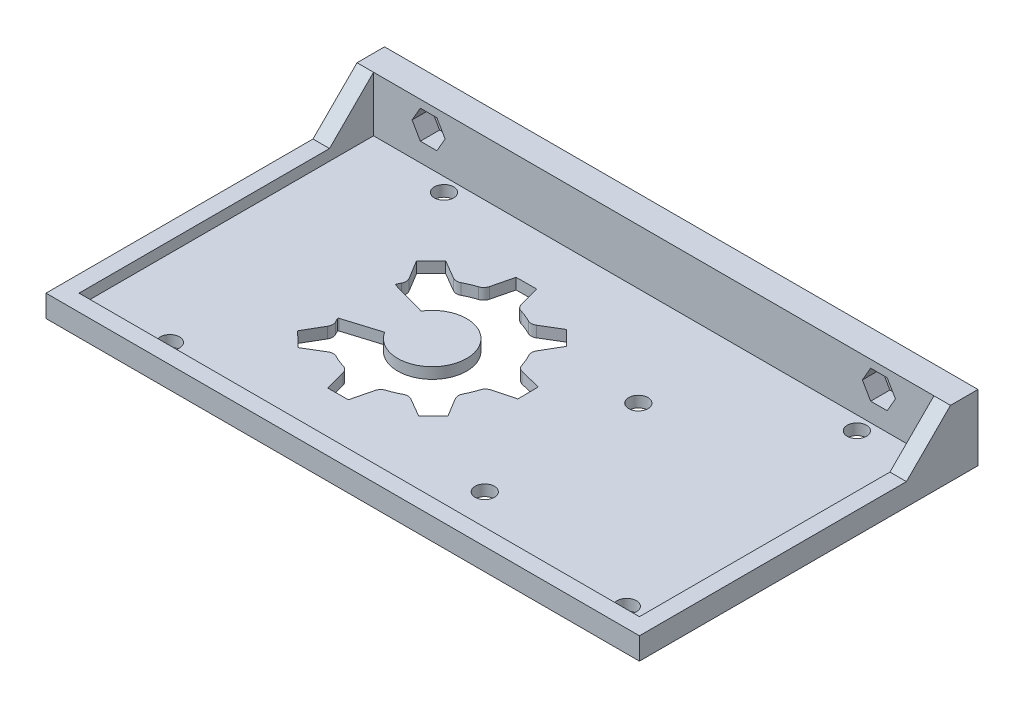
from build123d import *

# Parameters (mm, degrees)
SKETCH1_W           = 107.8
SKETCH1_H           = 59.5
SKETCH1_R           = 1.75
BOSS_EXTRUDE1_DEPTH = 2
BOSS_EXTRUDE2_START = 2
SKETCH1_3_W         = 107.8
SKETCH1_3_H         = 59.5
SKETCH1_3_W_2       = 101.8
SKETCH1_3_H_2       = 53.5
SKETCH1_3_R         = 1.75
BOSS_EXTRUDE2_DEPTH = 2
SKETCH3_W           = 107.8
SKETCH3_H           = 5
BOSS_EXTRUDE3_DEPTH = 12
CHAMFER1_SIZE       = 8
CUT_EXTRUDE1_DEPTH  = 3.5
SKETCH4_4_R         = 1.75
CUT_EXTRUDE3_DEPTH  = 120.663235791


with BuildPart() as part:
    # Sketch1 → Boss-Extrude1 (new body)
    with BuildSketch(Plane(origin=(0, 0, 0), x_dir=(1, 0, 0), z_dir=(0, 1, 0))):
        with Locations((50.9, 26.75)):
            Rectangle(SKETCH1_W, SKETCH1_H)
        with Locations(Location((15.3, 51, 0), (0, 0, 270))):
            Circle(SKETCH1_R, mode=Mode.SUBTRACT)
        with Locations(Location((14, 2.5, 0), (0, 0, 270))):
            Circle(SKETCH1_R, mode=Mode.SUBTRACT)
        with Locations(Location((90.3, 51, 0), (0, 0, 270))):
            Circle(SKETCH1_R, mode=Mode.SUBTRACT)
        with Locations(Location((97, 2.5, 0), (0, 0, 270))):
            Circle(SKETCH1_R, mode=Mode.SUBTRACT)
        with Locations(Location((66.1, 35.5, 0), (0, 0, 270))):
            Circle(SKETCH1_R, mode=Mode.SUBTRACT)
        with Locations(Location((66.1, 7.6, 0), (0, 0, 270))):
            Circle(SKETCH1_R, mode=Mode.SUBTRACT)
        with BuildLine():
            Line((23.594839055, 37.705508722), (26.221634516, 40.37685674))
            Line((26.221634516, 40.37685674), (29.668285754, 38.370965683))
            ThreePointArc((29.668285754, 38.370965683), (30.368695169, 38.175736851), (31.075200762, 38.347601602))
            ThreePointArc((31.075200762, 38.347601602), (32.158474755, 38.867522419), (33.285245302, 39.284881177))
            ThreePointArc((33.285245302, 39.284881177), (33.899901464, 39.673320939), (34.246417166, 40.312550564))
            Line((34.246417166, 40.312550564), (35.200205995, 44.184667628))
            Line((35.200205995, 44.184667628), (38.946559177, 44.216171044))
            Line((38.946559177, 44.216171044), (39.96533047, 40.360641412))
            ThreePointArc((39.96533047, 40.360641412), (40.322547086, 39.727329534), (40.943648713, 39.349281369))
            ThreePointArc((40.943648713, 39.349281369), (42.077278635, 38.950930518), (43.169142938, 38.449300631))
            ThreePointArc((43.169142938, 38.449300631), (43.878438868, 38.28934148), (44.575466073, 38.49632148))
            Line((44.575466073, 38.49632148), (47.987896856, 40.559891165))
            Line((47.987896856, 40.559891165), (50.659244873, 37.933095705))
            Line((50.659244873, 37.933095705), (48.653353816, 34.486444467))
            ThreePointArc((48.653353816, 34.486444467), (48.458124984, 33.786035052), (48.629989735, 33.079529459))
            ThreePointArc((48.629989735, 33.079529459), (49.149910552, 31.996255466), (49.56726931, 30.869484918))
            ThreePointArc((49.56726931, 30.869484918), (49.955709072, 30.254828756), (50.594938697, 29.908313054))
            Line((50.594938697, 29.908313054), (54.467055761, 28.954524225))
            Line((54.467055761, 28.954524225), (54.498559177, 25.208171044))
            Line((54.498559177, 25.208171044), (50.643029545, 24.18939975))
            ThreePointArc((50.643029545, 24.18939975), (50.009717667, 23.832183134), (49.631669502, 23.211081507))
            ThreePointArc((49.631669502, 23.211081507), (49.233318651, 22.077451586), (48.731688764, 20.985587282))
            ThreePointArc((48.731688764, 20.985587282), (48.571729613, 20.276291353), (48.778709614, 19.579264147))
            Line((48.778709614, 19.579264147), (50.842279299, 16.166833365))
            Line((50.842279299, 16.166833365), (48.215483838, 13.495485347))
            Line((48.215483838, 13.495485347), (44.7688326, 15.501376404))
            ThreePointArc((44.7688326, 15.501376404), (44.068423185, 15.696605237), (43.361917592, 15.524740485))
            ThreePointArc((43.361917592, 15.524740485), (42.278643599, 15.004819668), (41.151873051, 14.58746091))
            ThreePointArc((41.151873051, 14.58746091), (40.537216889, 14.199021149), (40.190701187, 13.559791523))
            Line((40.190701187, 13.559791523), (39.236912358, 9.687674459))
            Line((39.236912358, 9.687674459), (35.490559177, 9.656171044))
            Line((35.490559177, 9.656171044), (34.471787883, 13.511700675))
            ThreePointArc((34.471787883, 13.511700675), (34.114571267, 14.145012554), (33.49346964, 14.523060718))
            ThreePointArc((33.49346964, 14.523060718), (32.359839719, 14.921411569), (31.267975415, 15.423041456))
            ThreePointArc((31.267975415, 15.423041456), (30.558679486, 15.583000607), (29.86165228, 15.376020607))
            Line((29.86165228, 15.376020607), (26.449221498, 13.312450922))
            Line((26.449221498, 13.312450922), (23.77787348, 15.939246383))
            Line((23.77787348, 15.939246383), (25.783764538, 19.38589762))
            ThreePointArc((25.783764538, 19.38589762), (25.97899337, 20.086307036), (25.807128618, 20.792812629))
            ThreePointArc((25.807128618, 20.792812629), (25.63505412, 21.123769595), (25.472575587, 21.45954165))
            ThreePointArc((25.472575587, 21.45954165), (25.471521134, 21.57140422), (25.555142885, 21.645712693))
            Line((25.555142885, 21.645712693), (31.904076526, 23.60710923))
            ThreePointArc((31.904076526, 23.60710923), (43.489618325, 26.950155118), (31.889282249, 30.24149793))
            Line((31.889282249, 30.24149793), (25.46834976, 32.027118633))
            ThreePointArc((25.46834976, 32.027118633), (25.382322518, 32.099718242), (25.381148957, 32.212279391))
            ThreePointArc((25.381148957, 32.212279391), (25.538419769, 32.551858304), (25.705429589, 32.886754805))
            ThreePointArc((25.705429589, 32.886754805), (25.86538874, 33.596050734), (25.65840874, 34.29307794))
            Line((25.65840874, 34.29307794), (23.594839055, 37.705508722))
        make_face(mode=Mode.SUBTRACT)
    extrude(amount=BOSS_EXTRUDE1_DEPTH)

    # Sketch1<3> → Boss-Extrude2 (add)
    # profile 1 of 8: a face of its own
    with BuildSketch(Plane(origin=(0, 0, 0), x_dir=(1, 0, 0), z_dir=(0, 1, 0)).offset(BOSS_EXTRUDE2_START)):
        with Locations((50.9, 26.75)):
            Rectangle(SKETCH1_3_W, SKETCH1_3_H)
        with Locations((50.9, 26.75)):
            Rectangle(SKETCH1_3_W_2, SKETCH1_3_H_2, mode=Mode.SUBTRACT)
    # profile 2 of 8: a face of its own
    with BuildSketch(Plane(origin=(0, 0, 0), x_dir=(1, 0, 0), z_dir=(0, 1, 0)).offset(BOSS_EXTRUDE2_START)):
        with Locations(Location((66.1, 7.6, 0), (0, 0, 270))):
            Circle(SKETCH1_3_R)
    # profile 3 of 8: a face of its own
    with BuildSketch(Plane(origin=(0, 0, 0), x_dir=(1, 0, 0), z_dir=(0, 1, 0)).offset(BOSS_EXTRUDE2_START)):
        with Locations(Location((66.1, 35.5, 0), (0, 0, 270))):
            Circle(SKETCH1_3_R)
    # profile 4 of 8: a face of its own
    with BuildSketch(Plane(origin=(0, 0, 0), x_dir=(1, 0, 0), z_dir=(0, 1, 0)).offset(BOSS_EXTRUDE2_START)):
        with Locations(Location((97, 2.5, 0), (0, 0, 270))):
            Circle(SKETCH1_3_R)
    # profile 5 of 8: a face of its own
    with BuildSketch(Plane(origin=(0, 0, 0), x_dir=(1, 0, 0), z_dir=(0, 1, 0)).offset(BOSS_EXTRUDE2_START)):
        with Locations(Location((90.3, 51, 0), (0, 0, 270))):
            Circle(SKETCH1_3_R)
    # profile 6 of 8: a face of its own
    with BuildSketch(Plane(origin=(0, 0, 0), x_dir=(1, 0, 0), z_dir=(0, 1, 0)).offset(BOSS_EXTRUDE2_START)):
        with Locations(Location((14, 2.5, 0), (0, 0, 270))):
            Circle(SKETCH1_3_R)
    # profile 7 of 8: a face of its own
    with BuildSketch(Plane(origin=(0, 0, 0), x_dir=(1, 0, 0), z_dir=(0, 1, 0)).offset(BOSS_EXTRUDE2_START)):
        with Locations(Location((15.3, 51, 0), (0, 0, 270))):
            Circle(SKETCH1_3_R)
    # profile 8 of 8: a face of its own
    with BuildSketch(Plane(origin=(0, 0, 0), x_dir=(1, 0, 0), z_dir=(0, 1, 0)).offset(BOSS_EXTRUDE2_START)):
        with BuildLine():
            Line((23.594839055, 37.705508722), (26.221634516, 40.37685674))
            Line((26.221634516, 40.37685674), (29.668285754, 38.370965683))
            ThreePointArc((29.668285754, 38.370965683), (30.368695169, 38.175736851), (31.075200762, 38.347601602))
            ThreePointArc((31.075200762, 38.347601602), (32.158474755, 38.867522419), (33.285245302, 39.284881177))
            ThreePointArc((33.285245302, 39.284881177), (33.899901464, 39.673320939), (34.246417166, 40.312550564))
            Line((34.246417166, 40.312550564), (35.200205995, 44.184667628))
            Line((35.200205995, 44.184667628), (38.946559177, 44.216171044))
            Line((38.946559177, 44.216171044), (39.96533047, 40.360641412))
            ThreePointArc((39.96533047, 40.360641412), (40.322547086, 39.727329534), (40.943648713, 39.349281369))
            ThreePointArc((40.943648713, 39.349281369), (42.077278635, 38.950930518), (43.169142938, 38.449300631))
            ThreePointArc((43.169142938, 38.449300631), (43.878438868, 38.28934148), (44.575466073, 38.49632148))
            Line((44.575466073, 38.49632148), (47.987896856, 40.559891165))
            Line((47.987896856, 40.559891165), (50.659244873, 37.933095705))
            Line((50.659244873, 37.933095705), (48.653353816, 34.486444467))
            ThreePointArc((48.653353816, 34.486444467), (48.458124984, 33.786035052), (48.629989735, 33.079529459))
            ThreePointArc((48.629989735, 33.079529459), (49.149910552, 31.996255466), (49.56726931, 30.869484918))
            ThreePointArc((49.56726931, 30.869484918), (49.955709072, 30.254828756), (50.594938697, 29.908313054))
            Line((50.594938697, 29.908313054), (54.467055761, 28.954524225))
            Line((54.467055761, 28.954524225), (54.498559177, 25.208171044))
            Line((54.498559177, 25.208171044), (50.643029545, 24.18939975))
            ThreePointArc((50.643029545, 24.18939975), (50.009717667, 23.832183134), (49.631669502, 23.211081507))
            ThreePointArc((49.631669502, 23.211081507), (49.233318651, 22.077451586), (48.731688764, 20.985587282))
            ThreePointArc((48.731688764, 20.985587282), (48.571729613, 20.276291353), (48.778709614, 19.579264147))
            Line((48.778709614, 19.579264147), (50.842279299, 16.166833365))
            Line((50.842279299, 16.166833365), (48.215483838, 13.495485347))
            Line((48.215483838, 13.495485347), (44.7688326, 15.501376404))
            ThreePointArc((44.7688326, 15.501376404), (44.068423185, 15.696605237), (43.361917592, 15.524740485))
            ThreePointArc((43.361917592, 15.524740485), (42.278643599, 15.004819668), (41.151873051, 14.58746091))
            ThreePointArc((41.151873051, 14.58746091), (40.537216889, 14.199021149), (40.190701187, 13.559791523))
            Line((40.190701187, 13.559791523), (39.236912358, 9.687674459))
            Line((39.236912358, 9.687674459), (35.490559177, 9.656171044))
            Line((35.490559177, 9.656171044), (34.471787883, 13.511700675))
            ThreePointArc((34.471787883, 13.511700675), (34.114571267, 14.145012554), (33.49346964, 14.523060718))
            ThreePointArc((33.49346964, 14.523060718), (32.359839719, 14.921411569), (31.267975415, 15.423041456))
            ThreePointArc((31.267975415, 15.423041456), (30.558679486, 15.583000607), (29.86165228, 15.376020607))
            Line((29.86165228, 15.376020607), (26.449221498, 13.312450922))
            Line((26.449221498, 13.312450922), (23.77787348, 15.939246383))
            Line((23.77787348, 15.939246383), (25.783764538, 19.38589762))
            ThreePointArc((25.783764538, 19.38589762), (25.97899337, 20.086307036), (25.807128618, 20.792812629))
            ThreePointArc((25.807128618, 20.792812629), (25.63505412, 21.123769595), (25.472575587, 21.45954165))
            ThreePointArc((25.472575587, 21.45954165), (25.471521134, 21.57140422), (25.555142885, 21.645712693))
            Line((25.555142885, 21.645712693), (31.904076526, 23.60710923))
            ThreePointArc((31.904076526, 23.60710923), (43.489618325, 26.950155118), (31.889282249, 30.24149793))
            Line((31.889282249, 30.24149793), (25.46834976, 32.027118633))
            ThreePointArc((25.46834976, 32.027118633), (25.382322518, 32.099718242), (25.381148957, 32.212279391))
            ThreePointArc((25.381148957, 32.212279391), (25.538419769, 32.551858304), (25.705429589, 32.886754805))
            ThreePointArc((25.705429589, 32.886754805), (25.86538874, 33.596050734), (25.65840874, 34.29307794))
            Line((25.65840874, 34.29307794), (23.594839055, 37.705508722))
        make_face()
    extrude(amount=BOSS_EXTRUDE2_DEPTH)


with BuildPart() as boss_extrude2_kept_piece:
    # of the separate pieces the step leaves, the one the design keeps (boss_extrude2_pieces_kept)
    add(part.part.solids().sort_by_distance((-3, 0, -56.5))[0])

    # Sketch3 → Boss-Extrude3 (add)
    with BuildSketch(Plane.XZ):
        with Locations((50.9, -56)):
            Rectangle(SKETCH3_W, SKETCH3_H)
    extrude(amount=-BOSS_EXTRUDE3_DEPTH)

    # Chamfer1
    chamfer1_edges = [boss_extrude2_kept_piece.edges().sort_by_distance(p)[0] for p in [
        (-1.5, 4, -53.5),
        (103.3, 4, -53.5),
    ]]
    chamfer(chamfer1_edges, length=CHAMFER1_SIZE - 0.0001)  # a hair under: the kernel refuses the full size

    # Sketch4 → Cut-Extrude1 (cut)
    with BuildSketch(Plane.XY.offset(-53.5)):
        Polygon((11.5, 10.598076211), (8.5, 10.598076211), (7, 8), (8.5, 5.401923789), (11.5, 5.401923789), (13, 8), align=None)
        Polygon((90.3, 10.598076211), (93.3, 10.598076211), (94.8, 8), (93.3, 5.401923789), (90.3, 5.401923789), (88.8, 8), align=None)
    extrude(amount=-CUT_EXTRUDE1_DEPTH, mode=Mode.SUBTRACT)

    # Sketch4<4> → Cut-Extrude3 (cut, through all)
    with BuildSketch(Plane.XY.offset(-53.5)):
        with Locations((10, 8)):
            Circle(SKETCH4_4_R)
        with Locations(Location((91.8, 8, 0), (0, 0, 180))):
            Circle(SKETCH4_4_R)
    extrude(amount=-CUT_EXTRUDE3_DEPTH, mode=Mode.SUBTRACT)


solid = boss_extrude2_kept_piece.part
